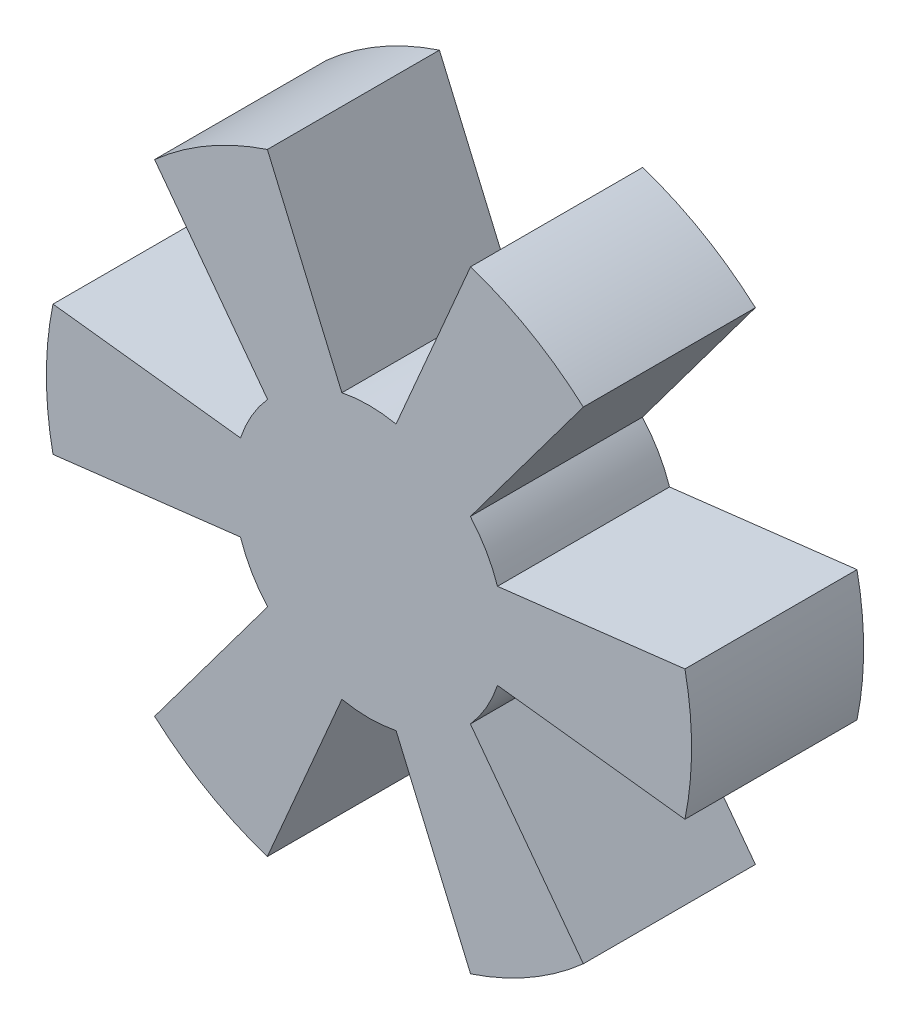
from build123d import *

# Parameters (mm, degrees)
SZKIC1_R                    = 47.625
SZKIC1_R_2                  = 20
DODANIE_WYCI_GNI_CIE1_DEPTH = 25.4
WYTNIJ_WYCI_GNI_CIE1_REACH  = 73.982
DODANIE_WYCI_GNI_CIE2_START = -25.4
SZKIC3_R                    = 20
DODANIE_WYCI_GNI_CIE2_DEPTH = 25.4
SZYK_KO_OWY1_COUNT          = 6


with BuildPart() as part:
    # Szkic1 → Dodanie-wyciągnięcie1 (new body)
    with BuildSketch(Plane.XY):
        Circle(SZKIC1_R)
        Circle(SZKIC1_R_2, mode=Mode.SUBTRACT)
    extrude(amount=DODANIE_WYCI_GNI_CIE1_DEPTH)

    # Szkic2 → Wytnij-wyciągnięcie1 (cut, up to next)
    with BuildSketch(Plane.XY.offset(25.4), mode=Mode.PRIVATE) as wytnij_wyci_gni_cie1_sk1:
        with BuildLine():
            Line((-4, -19.595917942), (-15, -45.201113095))
            ThreePointArc((-15, -45.201113095), (0, -47.625), (15, -45.201113095))
            Line((15, -45.201113095), (4, -19.595917942))
            ThreePointArc((4, -19.595917942), (0, -20), (-4, -19.595917942))
        make_face()
    wytnij_wyci_gni_cie1_tool1 = extrude(wytnij_wyci_gni_cie1_sk1.sketch, amount=-WYTNIJ_WYCI_GNI_CIE1_REACH, mode=Mode.PRIVATE) & part.part
    wytnij_wyci_gni_cie1 = wytnij_wyci_gni_cie1_tool1.solids().sort_by_distance((0, -35.963719, 25.4))[0]
    add(wytnij_wyci_gni_cie1, mode=Mode.SUBTRACT)

    # Szkic3 → Dodanie-wyciągnięcie2 (add)
    with BuildSketch(Plane.XY.offset(25.4).offset(DODANIE_WYCI_GNI_CIE2_START)):
        Circle(SZKIC3_R)
    extrude(amount=DODANIE_WYCI_GNI_CIE2_DEPTH)

    # Szyk kołowy1: Wytnij-wyciągnięcie1 ×6 about axis
    szyk_ko_owy1_axis = Axis((0, 0, 25.4), (0, 0, 1))
    for i in range(1, SZYK_KO_OWY1_COUNT):
        add(wytnij_wyci_gni_cie1.rotate(szyk_ko_owy1_axis, i * 360 / SZYK_KO_OWY1_COUNT), mode=Mode.SUBTRACT)


solid = part.part
